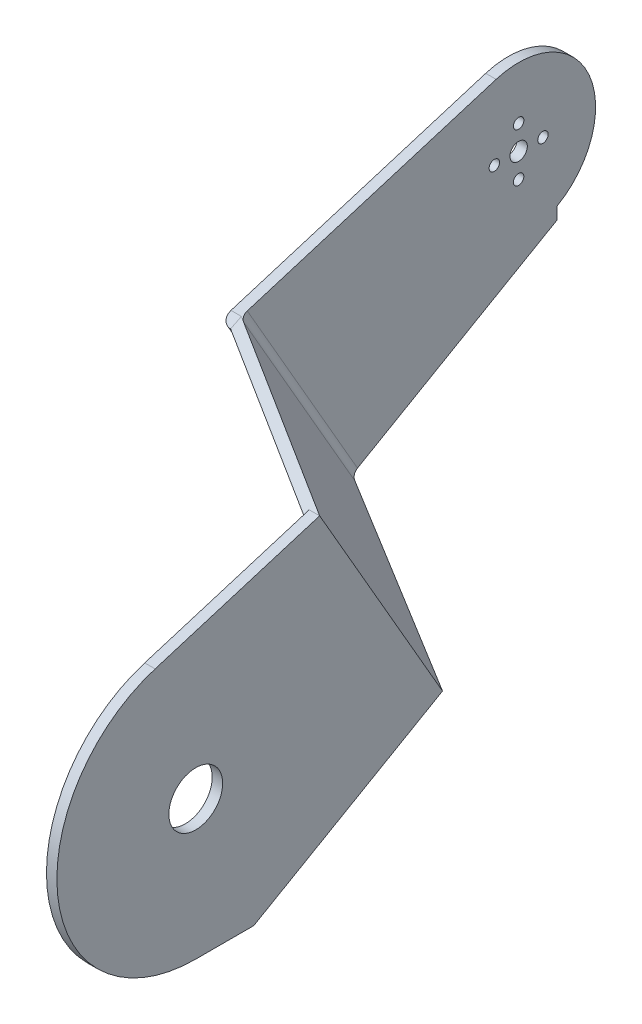
from build123d import *

# Parameters (mm, degrees)
SKETCH_2_R           = 3
SKETCH_2_R_2         = 1.5
SKETCH_2_R_3         = 2.5
EXTRUDE_1_DEPTH      = 3
EXTRUDE_2_DEPTH      = 196
SKETCH_5_R           = 8
CUT_EXTRUDE_1_DEPTH  = 10
SKETCH_6_R           = 4.05
CUT_EXTRUDE_2_DEPTH  = 10
SKETCH_8_R           = 40
EXTRUDE_3_DEPTH      = 3
EXTRUDE_START        = -61
EXTRUDE_4_DEPTH      = 64
EXTRUDE_5_DEPTH      = 3
EXTRUDE_START_2      = -3
EXTRUDE_14_DEPTH     = 3
EXTRUDE_15_DEPTH     = 3
SKETCH_16_R          = 40
EXTRUDE_16_DEPTH     = 3
CUT_EXTRUDE_START    = -20
CUT_EXTRUDE_5_DEPTH  = 20
CUT_EXTRUDE_6_DEPTH  = 20
CUT_EXTRUDE_7_DEPTH  = 3
FILLET_3_R           = 3
FILLET_4_R           = 3
FILLET_5_R           = 3
FILLET_6_R           = 3
SKETCH_22_R          = 7.75
CUT_EXTRUDE_8_DEPTH  = 10
SKETCH_23_R          = 4.05
CUT_EXTRUDE_9_DEPTH  = 10
CUT_EXTRUDE_10_DEPTH = 10
CUT_EXTRUDE_11_DEPTH = 10
SKETCH_26_W          = 471.047466431
SKETCH_26_H          = 304.479350924
CUT_EXTRUDE_12_DEPTH = 135


# Some blends are built 0.0001 mm under size
with BuildPart() as part:
    # 草图2 → 凸台-拉伸1 (new body)
    with BuildSketch(Plane(origin=(0, 0, 0), x_dir=(0, 0, -1), z_dir=(1, 0, 0))):
        with BuildLine():
            Line((138.514809283, 84.200667909), (-11.70063651, 38.25042621))
            ThreePointArc((-11.70063651, 38.25042621), (-39.560188627, -5.915359313), (0, -40))
            Line((0, -40), (16.710190716, -40))
            Line((16.710190716, -40), (156.071648789, 40.329376559))
            Line((156.071648789, 40.329376559), (156.071648789, 43.792069046))
            ThreePointArc((156.071648789, 43.792069046), (165.334026038, 71.834783727), (138.514809283, 84.200667909))
        make_face()
        Circle(SKETCH_2_R, mode=Mode.SUBTRACT)
        with Locations((145, 70)):
            Circle(SKETCH_2_R_2, mode=Mode.SUBTRACT)
        with Locations((138, 63)):
            Circle(SKETCH_2_R_2, mode=Mode.SUBTRACT)
        with Locations((145, 56)):
            Circle(SKETCH_2_R_2, mode=Mode.SUBTRACT)
        with Locations((145, 63)):
            Circle(SKETCH_2_R_3, mode=Mode.SUBTRACT)
        with Locations((152, 63)):
            Circle(SKETCH_2_R_2, mode=Mode.SUBTRACT)
    extrude_1 = extrude(amount=EXTRUDE_1_DEPTH)

    # 草图4 → 凸台-拉伸2 (add)
    with BuildSketch(Plane(origin=(3, 0, 0), x_dir=(0, 0, -1), z_dir=(1, 0, 0))):
        with BuildLine():
            Line((0, -40), (16.710190716, -40))
            Line((16.710190716, -40), (156.071648789, 40.329376559))
            Line((156.071648789, 40.329376559), (156.071648789, 43.792069046))
            Line((156.071648789, 43.792069046), (19.975563357, -34.655113166))
            ThreePointArc((19.975563357, -34.655113166), (10.339136167, -38.640681455), (0, -40))
        make_face()
    extrude(amount=EXTRUDE_2_DEPTH)

    # 镜向2: 凸台-拉伸1 across plane
    add(extrude_1.mirror(Plane(origin=(101, 0, 0), x_dir=(0, 0, 1), z_dir=(1, 0, 0))))

    # 草图5 → 切除-拉伸1 (cut)
    with BuildSketch(Plane(origin=(202, 0, 0), x_dir=(0, 0, -1), z_dir=(1, 0, 0))):
        Circle(SKETCH_5_R)
    extrude(amount=-CUT_EXTRUDE_1_DEPTH, mode=Mode.SUBTRACT)

    # 草图6 → 切除-拉伸2 (cut)
    with BuildSketch(Plane.ZY):
        Circle(SKETCH_6_R)
    extrude(amount=-CUT_EXTRUDE_2_DEPTH, mode=Mode.SUBTRACT)

    # 草图9 → 凸台-拉伸4 (add)
    with BuildSketch(Plane(origin=(251, 0, 0), x_dir=(0, 0, -1), z_dir=(1, 0, 0)).offset(EXTRUDE_START)):
        with BuildLine():
            Line((0, -40), (16.710190716, -40))
            Line((16.710190716, -40), (53.747942483, -18.651059269))
            Line((53.747942483, -18.651059269), (52.249775231, -16.051925781))
            Line((52.249775231, -16.051925781), (19.975563357, -34.655113166))
            ThreePointArc((19.975563357, -34.655113166), (10.339136167, -38.640681455), (0, -40))
        make_face()
    extrude_4 = extrude(amount=EXTRUDE_4_DEPTH)

    # 草图10 → 凸台-拉伸5 (add)
    with BuildSketch(Plane(origin=(0, -37.254246654, -21.473730609), x_dir=(1, 0, 0), z_dir=(0, -0.8663778291595938, -0.49938908392225567))):
        Polygon((254, -37.251890328), (254, -57.251890328), (202, -87.274104325), (202, -37.251890328), align=None)
    extrude_5 = extrude(amount=-EXTRUDE_5_DEPTH)



with BuildPart() as body_2:
    # 草图8 → 凸台-拉伸3 (new body)
    with BuildSketch(Plane(origin=(251, 0, 0), x_dir=(0, 0, -1), z_dir=(1, 0, 0))):
        Circle(SKETCH_8_R)
    extrude(amount=EXTRUDE_3_DEPTH)


with BuildPart() as part_1:
    add(part.part)

    add(body_2.part)  # 凸台-拉伸14 merges body 2
    # 草图14 → 凸台-拉伸14 (add)
    with BuildSketch(Plane(origin=(254, 0, 0), x_dir=(0, 0, -1), z_dir=(1, 0, 0)).offset(EXTRUDE_START_2)):
        with BuildLine():
            Line((-11.70063651, 38.25042621), (35.679778873, 52.743886101))
            Line((35.679778873, 52.743886101), (69.577331814, -6.064144103))
            Line((69.577331814, -6.064144103), (19.975563357, -34.655113166))
            ThreePointArc((19.975563357, -34.655113166), (36.686823541, 15.939792297), (-11.70063651, 38.25042621))
        make_face()
    extrude_14 = extrude(amount=EXTRUDE_14_DEPTH)

    # 草图15 → 凸台-拉伸15 (add)
    with BuildSketch(Plane(origin=(88.290795719, 76.368648195, -132.490087928), x_dir=(-0.8660254037844362, 0.24969454196113006, -0.43318891457980085), z_dir=(0.5000000000000046, 0.43248363304931103, -0.7503052093278205))):
        Polygon((-191.344507397, -43), (-191.344507397, 27.878041456), (-131.300079402, 20.97393325), (-131.300079402, -43), align=None)
    extrude_15 = extrude(amount=-EXTRUDE_15_DEPTH)

    # 镜向8: 凸台-拉伸15 across plane
    add(extrude_15.mirror(Plane(origin=(101, 0, 0), x_dir=(0, 0, 1), z_dir=(1, 0, 0))))

    # 镜向10: 凸台-拉伸5 across plane
    add(extrude_5.mirror(Plane(origin=(101, 0, 0), x_dir=(0, 0, 1), z_dir=(1, 0, 0))))

    # 镜向11: 凸台-拉伸4 across plane
    add(extrude_4.mirror(Plane(origin=(101, 0, 0), x_dir=(0, 0, 1), z_dir=(1, 0, 0))))

    # 镜向12: 凸台-拉伸14 across plane
    add(extrude_14.mirror(Plane(origin=(101, 0, 0), x_dir=(0, 0, 1), z_dir=(1, 0, 0))))

    # 草图16 → 凸台-拉伸16 (add)
    with BuildSketch(Plane.ZY.offset(52)):
        Circle(SKETCH_16_R)
    extrude(amount=-EXTRUDE_16_DEPTH)

    # 草图17 → 切除-拉伸5 (cut)
    with BuildSketch(Plane(origin=(202, 0, 0), x_dir=(0, 0, -1), z_dir=(1, 0, 0)).offset(CUT_EXTRUDE_START)):
        with BuildLine():
            Line((-11.120326036, 38.423148607), (61.739147636, 60.715331959))
            Line((61.739147636, 60.715331959), (65.138195736, 61.755085767))
            Line((65.138195736, 61.755085767), (62.037518083, 60.197696416))
            Line((62.037518083, 60.197696416), (92.586691567, 7.198687311))
            Line((92.586691567, 7.198687311), (19.975563357, -34.655113166))
            ThreePointArc((19.975563357, -34.655113166), (-36.806411031, -15.66167638), (-11.120326036, 38.423148607))
        make_face()
    extrude(amount=CUT_EXTRUDE_5_DEPTH, mode=Mode.SUBTRACT)


with BuildPart() as cut_extrude_5_piece_1:
    # of the separate pieces the step leaves, piece 1, a body of its own (cut_extrude_5_pieces)
    add(part_1.part.solids().sort_by_distance((0, 43.792069046, -156.071648789))[0])

    # 草图21 → 切除-拉伸7 (cut)
    with BuildSketch(Plane(origin=(3, 0, 0), x_dir=(0, 0, -1), z_dir=(1, 0, 0))):
        with BuildLine():
            Line((92.586691567, 7.198687311), (62.037518083, 60.197696416))
            Line((62.037518083, 60.197696416), (65.138195736, 61.755085767))
            Line((65.138195736, 61.755085767), (61.739147636, 60.715331959))
            Line((61.739147636, 60.715331959), (-11.70063651, 38.25042621))
            ThreePointArc((-11.70063651, 38.25042621), (-36.686823541, -15.939792297), (19.975563357, -34.655113166))
            Line((19.975563357, -34.655113166), (92.586691567, 7.198687311))
        make_face()
    extrude(amount=-CUT_EXTRUDE_7_DEPTH, mode=Mode.SUBTRACT)

    # 圆角3
    fillet_3_edges = [cut_extrude_5_piece_1.edges().sort_by_distance(p)[0] for p in [
        (3, 33.698191863, -77.312104825),
    ]]
    fillet(fillet_3_edges, radius=FILLET_3_R - 0.0001)  # a hair under: the kernel refuses the full size

    # 圆角4
    fillet_4_edges = [cut_extrude_5_piece_1.edges().sort_by_distance(p)[0] for p in [
        (199, 33.698191863, -77.312104825),
    ]]
    fillet(fillet_4_edges, radius=FILLET_4_R - 0.0001)  # a hair under: the kernel refuses the full size

    # 圆角5
    # the kernel refuses this fillet: 3 mm, written as the material it adds along each edge
    with BuildSketch(Plane(origin=(202, 65.506611814, -62.97577757), x_dir=(0, 0.49938908392225567, -0.8663778291595938), z_dir=(0, -0.8663778291595938, -0.49938908392225567))) as fillet_5_piece_1_section:
        with BuildLine():
            CenterArc((FILLET_5_R * 0.57735026919, FILLET_5_R), FILLET_5_R, 210, 60)
            Line((-FILLET_5_R * 0.288675134595, FILLET_5_R * 0.5), (0, 0))
            Line((0, 0), (FILLET_5_R * 0.57735026919, 0))
        make_face()
    fillet_5_piece_1 = extrude(amount=68.304060269, mode=Mode.PRIVATE)
    fillet_5_piece_1 = split(fillet_5_piece_1, bisect_by=Plane(origin=(202.325553984, 63.906694987, -72.171998522), z_dir=(0, -0.9562606552534866, -0.2925159127537726)), keep=Keep.TOP, mode=Mode.PRIVATE)
    fillet_5_piece_1 = split(fillet_5_piece_1, bisect_by=Plane(origin=(199.177617764, 62.412552566, -67.072312804), z_dir=(0.09892666816624703, -0.8892295154916122, -0.446636746253684)), keep=Keep.TOP, mode=Mode.PRIVATE)
    add(fillet_5_piece_1)

    # 圆角6
    # the kernel refuses this fillet: 3 mm, written as the material it adds along each edge
    with BuildSketch(Plane(origin=(0, 6.329488355, -97.086079656), x_dir=(0, 0.49938908392225556, -0.8663778291595938), z_dir=(0, 0.8663778291595938, 0.4993890839222556))) as fillet_6_piece_1_section:
        with BuildLine():
            CenterArc((FILLET_6_R * 0.57735026919, FILLET_6_R), FILLET_6_R, 210, 60)
            Line((-FILLET_6_R * 0.288675134595, FILLET_6_R * 0.5), (0, 0))
            Line((0, 0), (FILLET_6_R * 0.57735026919, 0))
        make_face()
    fillet_6_piece_1 = extrude(amount=68.304060269, mode=Mode.PRIVATE)
    fillet_6_piece_1 = split(fillet_6_piece_1, bisect_by=Plane(origin=(-0.325553984, 63.906694987, -72.171998522), z_dir=(0, -0.9562606552534866, -0.2925159127537726)), keep=Keep.TOP, mode=Mode.PRIVATE)
    fillet_6_piece_1 = split(fillet_6_piece_1, bisect_by=Plane(origin=(2.822382236, 62.412552566, -67.072312804), z_dir=(-0.09892666816624703, -0.8892295154916122, -0.446636746253684)), keep=Keep.TOP, mode=Mode.PRIVATE)
    add(fillet_6_piece_1)

    # 草图22 → 切除-拉伸8 (cut)
    with BuildSketch(Plane(origin=(254, 0, 0), x_dir=(0, 0, -1), z_dir=(1, 0, 0))):
        Circle(SKETCH_22_R)
    extrude(amount=-CUT_EXTRUDE_8_DEPTH, mode=Mode.SUBTRACT)

    # 草图23 → 切除-拉伸9 (cut)
    with BuildSketch(Plane.ZY.offset(52)):
        Circle(SKETCH_23_R)
    extrude(amount=-CUT_EXTRUDE_9_DEPTH, mode=Mode.SUBTRACT)

    # 草图24 → 切除-拉伸10 (cut)
    with BuildSketch(Plane(origin=(0, -34.655113166, -19.975563357), x_dir=(1, 0, 0), z_dir=(0, 0.8663778291595939, 0.4993890839222556))):
        with BuildLine():
            Line((3, 179.256683584), (3, 86.81000271))
            ThreePointArc((3, 86.81000271), (2.121320344, 84.688682367), (0, 83.81000271))
            Line((0, 83.81000271), (-49, 55.51983952))
            Line((-49, 55.51983952), (-49, -19.975563357))
            Line((-49, -19.975563357), (251, -19.975563357))
            Line((251, -19.975563357), (251, 55.51983952))
            Line((251, 55.51983952), (202, 83.81000271))
            ThreePointArc((202, 83.81000271), (199.878679656, 84.688682367), (199, 86.81000271))
            Line((199, 86.81000271), (199, 179.256683584))
            Line((199, 179.256683584), (3, 179.256683584))
        make_face()
    extrude(amount=-CUT_EXTRUDE_10_DEPTH, mode=Mode.SUBTRACT)

    # 草图25 → 切除-拉伸11 (cut)
    with BuildSketch(Plane.XZ.offset(40)):
        Polygon((-49, 40), (-49, -27.969882149), (251, -27.969882149), (251, 42.699584458), align=None)
    extrude(amount=-CUT_EXTRUDE_11_DEPTH, mode=Mode.SUBTRACT)


with BuildPart() as cut_extrude_5_piece_2:
    # of the separate pieces the step leaves, piece 2, a body of its own (cut_extrude_5_pieces)
    add(part_1.part.solids().sort_by_distance((202, 60.715331959, -61.739147636))[0])

    # 草图18 → 切除-拉伸6 (cut)
    with BuildSketch(Plane(origin=(0, 38.25042621, 11.70063651), x_dir=(1, 0, 0), z_dir=(0, 0.9562606552534866, 0.2925159127537726))):
        Polygon((199, 76.798918519), (202, 76.932821805), (202, 0), (199, 0), align=None)
    extrude(amount=-CUT_EXTRUDE_6_DEPTH, mode=Mode.SUBTRACT)


with BuildPart() as cut_extrude_11_piece_1:
    # of the separate pieces the step leaves, piece 1, a body of its own (cut_extrude_11_pieces)
    add(cut_extrude_5_piece_1.part.solids().sort_by_distance((-1.5, 5.897004722, -96.335774447))[0])

    # 草图26 → 切除-拉伸12 (cut)
    with BuildSketch(Plane(origin=(3, 0, 0), x_dir=(0, 0, -1), z_dir=(1, 0, 0))):
        with Locations((179.814409689, 100.362016139)):
            Rectangle(SKETCH_26_W, SKETCH_26_H)
    extrude(amount=-CUT_EXTRUDE_12_DEPTH, mode=Mode.SUBTRACT)


with BuildPart() as cut_extrude_11_piece_2:
    # of the separate pieces the step leaves, piece 2, a body of its own (cut_extrude_11_pieces)
    add(cut_extrude_5_piece_1.part.solids().sort_by_distance((251, -40, 0))[0])


solid = cut_extrude_11_piece_2.part
